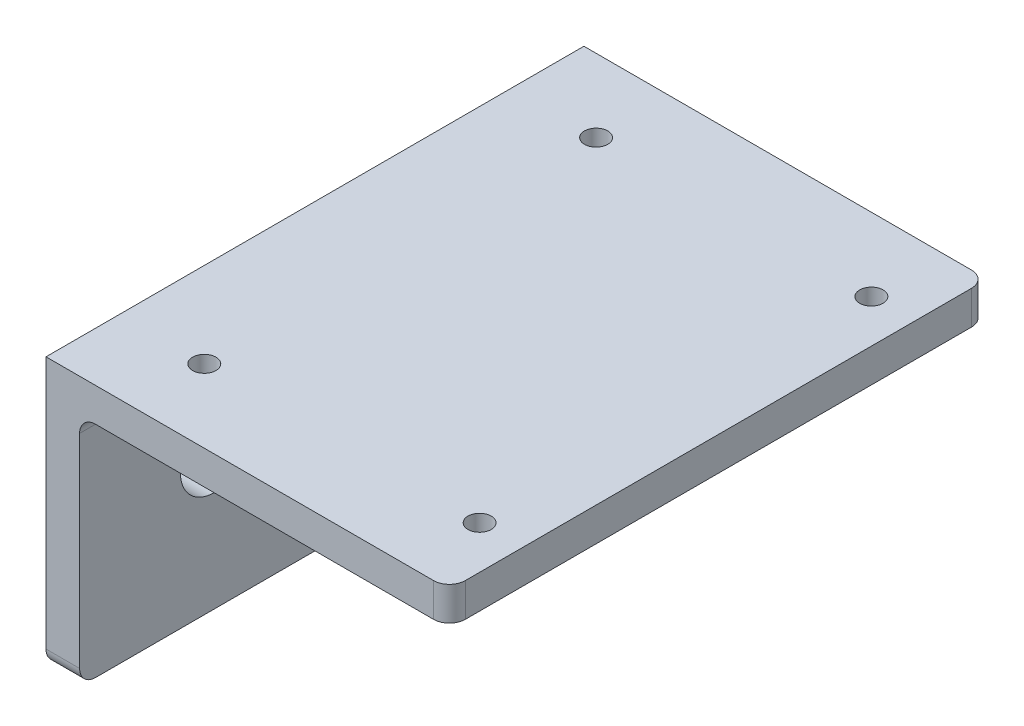
from build123d import *

# Parameters (mm, degrees)
SKETCH2_W           = 50.8
SKETCH2_H           = 25.4
BOSS_EXTRUDE1_DEPTH = 3.175
SKETCH4_W           = 38.1
SKETCH4_H           = 50.8
BOSS_EXTRUDE2_DEPTH = 3.175
SKETCH5_R           = 1.1
CUT_EXTRUDE1_DEPTH  = 3.175
SKETCH6_R           = 3.175
CUT_EXTRUDE2_DEPTH  = 3.175
BOSS_EXTRUDE3_DEPTH = 1.5875
FILLET3_R           = 1.5


with BuildPart() as part:
    # Sketch2 → Boss-Extrude1 (new body)
    with BuildSketch(Plane(origin=(0, 0, 0), x_dir=(0, 0, -1), z_dir=(1, 0, 0))):
        Rectangle(SKETCH2_W, SKETCH2_H)
    extrude(amount=BOSS_EXTRUDE1_DEPTH)

    # Sketch4 → Boss-Extrude2 (add)
    with BuildSketch(Plane(origin=(0, 12.7, 0), x_dir=(1, 0, 0), z_dir=(0, 1, 0))):
        with Locations((19.05, 0)):
            Rectangle(SKETCH4_W, SKETCH4_H)
    extrude(amount=-BOSS_EXTRUDE2_DEPTH)

    # Sketch5 → Cut-Extrude1 (cut)
    with BuildSketch(Plane(origin=(0, 12.7, 0), x_dir=(1, 0, 0), z_dir=(0, 1, 0))):
        with Locations(Location((8.05, 18.5, 0), (0, 0, 270))):
            Circle(SKETCH5_R)
        with Locations(Location((34.05, 18.5, 0), (0, 0, 270))):
            Circle(SKETCH5_R)
        with Locations(Location((34.05, -18.5, 0), (0, 0, 270))):
            Circle(SKETCH5_R)
        with Locations(Location((8.05, -18.5, 0), (0, 0, 270))):
            Circle(SKETCH5_R)
    extrude(amount=-CUT_EXTRUDE1_DEPTH, mode=Mode.SUBTRACT)

    # Sketch6 → Cut-Extrude2 (cut)
    with BuildSketch(Plane.ZY):
        with Locations((-12.7, 0)):
            Circle(SKETCH6_R)
        with Locations((12.7, 0)):
            Circle(SKETCH6_R)
    extrude(amount=-CUT_EXTRUDE2_DEPTH, mode=Mode.SUBTRACT)

    # Sketch7 → Boss-Extrude3 (add, symmetric)
    with BuildSketch(Plane.XY):
        Polygon((3.175, -12.7), (25.4, 9.525), (3.175, 9.525), align=None)
    extrude(amount=BOSS_EXTRUDE3_DEPTH, both=True)

    # Fillet3
    # the kernel refuses this fillet: 1.5 mm, written as the material it adds along each edge
    with BuildSketch(Plane(origin=(4.675, 8.025, 3.0875), x_dir=(-1, 0, 0), z_dir=(0, 1, 0))) as fillet3_piece_1_section:
        Polygon((0, 0), (FILLET3_R, 0), (FILLET3_R, -FILLET3_R), (0, -FILLET3_R), align=None)
    fillet3_piece_1 = extrude(amount=FILLET3_R, mode=Mode.PRIVATE)
    fillet3_piece_1 = fillet3_piece_1 - Plane(origin=(4.675, 8.025, 3.0875), x_dir=(0.7071067811865475, 0, 0.7071067811865475), z_dir=(0, 1, 0)) * Sphere(FILLET3_R, mode=Mode.PRIVATE)
    add(fillet3_piece_1)
    with BuildSketch(Plane(origin=(4.675, 8.025, -3.0875), x_dir=(0, 0, 1), z_dir=(0, 1, 0))) as fillet3_piece_2_section:
        Polygon((0, 0), (FILLET3_R, 0), (FILLET3_R, -FILLET3_R), (0, -FILLET3_R), align=None)
    fillet3_piece_2 = extrude(amount=FILLET3_R, mode=Mode.PRIVATE)
    fillet3_piece_2 = fillet3_piece_2 - Plane(origin=(4.675, 8.025, -3.0875), x_dir=(0.7071067811865475, 0, -0.7071067811865475), z_dir=(0, 1, 0)) * Sphere(FILLET3_R, mode=Mode.PRIVATE)
    add(fillet3_piece_2)
    with BuildSketch(Plane(origin=(3.175, 9.525, 25.4), x_dir=(0, -1, 0), z_dir=(0, 0, -1)), Plane(origin=(3.175, 9.525, -3.0875), x_dir=(0, -1, 0), z_dir=(0, 0, -1))) as fillet3_piece_3:
        with BuildLine():
            CenterArc((FILLET3_R, -FILLET3_R), FILLET3_R, 90, 90)
            Line((0, -FILLET3_R), (0, 0))
            Line((0, 0), (FILLET3_R, 0))
        make_face()
    extrude(amount=22.3125)
    with BuildSketch(Plane(origin=(29.15, 9.525, -1.5875), x_dir=(0, 0, -1), z_dir=(-1, 0, 0))) as fillet3_piece_4_section:
        with BuildLine():
            CenterArc((FILLET3_R, FILLET3_R), FILLET3_R, 180, 90)
            Line((0, FILLET3_R), (0, 0))
            Line((0, 0), (FILLET3_R, 0))
        make_face()
    fillet3_piece_4 = extrude(amount=24.475, mode=Mode.PRIVATE)
    fillet3_piece_4 = split(fillet3_piece_4, bisect_by=Plane(origin=(19.967902823, 4.092902823, -1.930123153), z_dir=(-0.707106781186549, 0.707106781186546, 0)), keep=Keep.TOP, mode=Mode.PRIVATE)
    add(fillet3_piece_4)
    with BuildSketch(Plane(origin=(25.4, 9.525, -1.5875), x_dir=(-0.7071067811865489, -0.7071067811865461, 0), z_dir=(0, 0, 1))) as fillet3_piece_5:
        with BuildLine():
            CenterArc((FILLET3_R * 0.414213562373, FILLET3_R), FILLET3_R, 225, 45)
            Line((-FILLET3_R * 0.292893218813, FILLET3_R * 0.292893218813), (0, 0))
            Line((0, 0), (FILLET3_R * 0.414213562373, 0))
        make_face()
    extrude(amount=3.175)
    with BuildSketch(Plane(origin=(3.175, 8.025, -1.5875), x_dir=(0, 0, -1), z_dir=(0, -1, 0))) as fillet3_piece_6_section:
        with BuildLine():
            CenterArc((FILLET3_R, FILLET3_R), FILLET3_R, 180, 90)
            Line((0, FILLET3_R), (0, 0))
            Line((0, 0), (FILLET3_R, 0))
        make_face()
    fillet3_piece_6 = extrude(amount=20.725, mode=Mode.PRIVATE)
    fillet3_piece_6 = split(fillet3_piece_6, bisect_by=Plane(origin=(8.60741784, -7.26758216, -1.930100054), z_dir=(-0.707106781186549, 0.707106781186546, 0)), keep=Keep.TOP, mode=Mode.PRIVATE)
    add(fillet3_piece_6)
    with BuildSketch(Plane(origin=(29.15, 9.525, 1.5875), x_dir=(0, 0, 1), z_dir=(-1, 0, 0))) as fillet3_piece_7_section:
        with BuildLine():
            CenterArc((FILLET3_R, -FILLET3_R), FILLET3_R, 90, 90)
            Line((0, -FILLET3_R), (0, 0))
            Line((0, 0), (FILLET3_R, 0))
        make_face()
    fillet3_piece_7 = extrude(amount=24.475, mode=Mode.PRIVATE)
    fillet3_piece_7 = split(fillet3_piece_7, bisect_by=Plane(origin=(19.967902823, 4.092902823, 1.930123153), z_dir=(-0.707106781186549, 0.707106781186546, 0)), keep=Keep.TOP, mode=Mode.PRIVATE)
    add(fillet3_piece_7)
    with BuildSketch(Plane(origin=(3.175, 8.025, 1.5875), x_dir=(0, 0, 1), z_dir=(0, -1, 0))) as fillet3_piece_8_section:
        with BuildLine():
            CenterArc((FILLET3_R, -FILLET3_R), FILLET3_R, 90, 90)
            Line((0, -FILLET3_R), (0, 0))
            Line((0, 0), (FILLET3_R, 0))
        make_face()
    fillet3_piece_8 = extrude(amount=20.725, mode=Mode.PRIVATE)
    fillet3_piece_8 = split(fillet3_piece_8, bisect_by=Plane(origin=(8.60741784, -7.26758216, 1.930100054), z_dir=(-0.707106781186549, 0.707106781186546, 0)), keep=Keep.TOP, mode=Mode.PRIVATE)
    add(fillet3_piece_8)
    with BuildSketch(Plane(origin=(25.4, 9.525, -3.140800859), x_dir=(-0.7071067811865446, -0.7071067811865503, 0), z_dir=(0, 0, 1))) as fillet3_piece_9a_section:
        with BuildLine():
            CenterArc((FILLET3_R * 0.414213562373, FILLET3_R), FILLET3_R, 225, 45)
            Line((-FILLET3_R * 0.292893218813, FILLET3_R * 0.292893218813), (0, 0))
            Line((0, 0), (FILLET3_R * 0.414213562373, 0))
        make_face()
    fillet3_piece_9a = extrude(amount=4.728300859, mode=Mode.PRIVATE)
    fillet3_piece_9a = split(fillet3_piece_9a, bisect_by=Plane(origin=(25.438403899, 9.432284787, -1.5875), z_dir=(0, 0, -1)), keep=Keep.TOP, mode=Mode.PRIVATE)
    with BuildSketch(Plane(origin=(29.15, 9.525, -1.5875), x_dir=(0, 0, -1), z_dir=(-1, 0, 0))) as fillet3_piece_9b_section:
        with BuildLine():
            CenterArc((FILLET3_R, FILLET3_R), FILLET3_R, 180, 90)
            Line((0, FILLET3_R), (0, 0))
            Line((0, 0), (FILLET3_R, 0))
        make_face()
    fillet3_piece_9b = extrude(amount=24.475, mode=Mode.PRIVATE)
    fillet3_piece_9b = split(fillet3_piece_9b, bisect_by=Plane(origin=(26.063627713, 10.188627713, -1.91198662), z_dir=(0.707106781186549, -0.707106781186546, 0)), keep=Keep.TOP, mode=Mode.PRIVATE)
    fillet3_piece_9 = fillet3_piece_9a & fillet3_piece_9b
    add(fillet3_piece_9)
    with BuildSketch(Plane(origin=(25.4, 9.525, -1.5875), x_dir=(-0.7071067811865489, -0.7071067811865461, 0), z_dir=(0, 0, 1))) as fillet3_piece_10a_section:
        with BuildLine():
            CenterArc((FILLET3_R * 0.414213562373, FILLET3_R), FILLET3_R, 225, 45)
            Line((-FILLET3_R * 0.292893218813, FILLET3_R * 0.292893218813), (0, 0))
            Line((0, 0), (FILLET3_R * 0.414213562373, 0))
        make_face()
    fillet3_piece_10a = extrude(amount=4.728300859, mode=Mode.PRIVATE)
    fillet3_piece_10a = split(fillet3_piece_10a, bisect_by=Plane(origin=(25.438403899, 9.432284787, 1.5875), z_dir=(0, 0, 1)), keep=Keep.TOP, mode=Mode.PRIVATE)
    with BuildSketch(Plane(origin=(29.15, 9.525, 1.5875), x_dir=(0, 0, 1), z_dir=(-1, 0, 0))) as fillet3_piece_10b_section:
        with BuildLine():
            CenterArc((FILLET3_R, -FILLET3_R), FILLET3_R, 90, 90)
            Line((0, -FILLET3_R), (0, 0))
            Line((0, 0), (FILLET3_R, 0))
        make_face()
    fillet3_piece_10b = extrude(amount=24.475, mode=Mode.PRIVATE)
    fillet3_piece_10b = split(fillet3_piece_10b, bisect_by=Plane(origin=(26.063627713, 10.188627713, 1.91198662), z_dir=(0.707106781186549, -0.707106781186546, 0)), keep=Keep.TOP, mode=Mode.PRIVATE)
    fillet3_piece_10 = fillet3_piece_10a & fillet3_piece_10b
    add(fillet3_piece_10)
    # the kernel refuses this fillet: 1.5 mm, written as the material it takes off along each edge
    with BuildSketch(Plane(origin=(38.1, 16.45, 25.4), x_dir=(0, 0, -1), z_dir=(0, -1, 0)), Plane(origin=(-3.75, -12.7, -25.4), x_dir=(0, 0, 1), z_dir=(1, 0, 0))) as fillet3_2_piece_1:
        with BuildLine():
            CenterArc((FILLET3_R, -FILLET3_R), FILLET3_R, 90, 90)
            Line((0, -FILLET3_R), (0, 0))
            Line((0, 0), (FILLET3_R, 0))
        make_face()
    extrude(amount=10.675, mode=Mode.SUBTRACT)
    with BuildSketch(Plane(origin=(38.1, 16.45, -25.4), x_dir=(0, 0, 1), z_dir=(0, -1, 0)), Plane(origin=(-3.75, -12.7, 25.4), x_dir=(0, 0, -1), z_dir=(1, 0, 0))) as fillet3_2_piece_2:
        with BuildLine():
            CenterArc((FILLET3_R, FILLET3_R), FILLET3_R, 180, 90)
            Line((0, FILLET3_R), (0, 0))
            Line((0, 0), (FILLET3_R, 0))
        make_face()
    extrude(amount=10.675, mode=Mode.SUBTRACT)


solid = part.part
